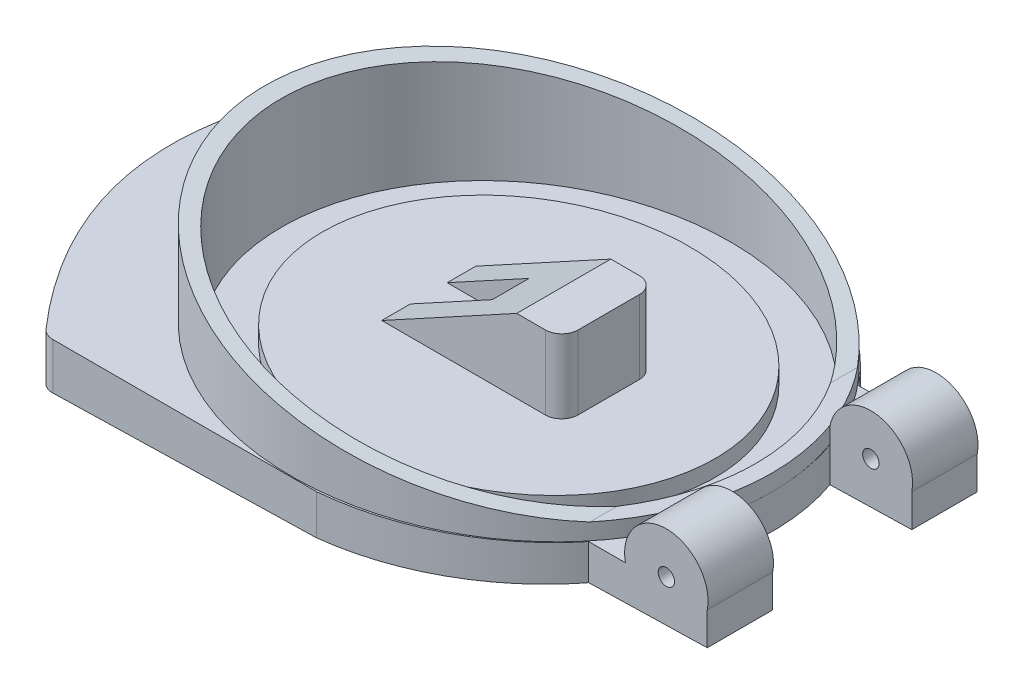
from build123d import *

# Parameters (mm, degrees)
BOSS_EXTRUDE5_DEPTH     = 4
SKETCH9_RX              = 31
SKETCH9_RY              = 27.762225355
SKETCH9_RX_2            = 29
SKETCH9_RY_2            = 25.88601257
BOSS_EXTRUDE6_DEPTH     = 12
CUT_EXTRUDE3_DEPTH      = 71
BOSS_EXTRUDE8_REACH     = 65.48
BOSS_EXTRUDE9_START     = -8
BOSS_EXTRUDE9_OUTLINE_R = 1
BOSS_EXTRUDE9_DEPTH     = 8
SKETCH14_RX             = 29
SKETCH14_RY             = 25.88601257
CUT_EXTRUDE4_DEPTH      = 2
BOSS_EXTRUDE10_DEPTH    = 9
SKETCH16_W              = 16.5
SKETCH16_H              = 3.468852831
CUT_EXTRUDE5_DEPTH      = 13
FILLET1_R               = 2
BOSS_EXTRUDE11_DEPTH    = 2
CUT_EXTRUDE6_DEPTH      = 80


with BuildPart() as part:
    # Sketch8 → Boss-Extrude5 (new body)
    with BuildSketch(Plane(origin=(0, 0, 0), x_dir=(1, 0, 0), z_dir=(0, 1, 0))):
        with BuildLine():
            add(Edge.make_bspline(
                [(-3.142440467, 27.855768953), (-31, 25.291948253), (-31, 0), (-31, -25.291948253), (-3.142440467, -27.855768953)],
                knots=[1.672339788, 1.672339788, 1.672339788, 3.141592654, 3.141592654, 4.610845519, 4.610845519, 4.610845519], degree=2, weights=[1, 0.742081211, 1, 0.742081211, 1]))
            Line((-3.142440467, 27.855768953), (-30, 27.855768953))
            add(Edge.make_bspline(
                [(-30, 27.855768953), (-55, 0), (-30, -27.855768953)],
                knots=[0, 0, 0, 1, 1, 1], degree=2))
            Line((-30, -27.855768953), (-3.142440467, -27.855768953))
        make_face()
        with BuildLine():
            add(Edge.make_bspline(
                [(31, 0), (31, 4.352704938), (29.537069195, 8.5)],
                knots=[0, 0, 0, 0.308438744, 0.308438744, 0.308438744], degree=2, weights=[1, 0.988131743, 1]))
            add(Edge.make_bspline(
                [(29.537069195, 8.5), (28.009992177, 12.829144588), (25.0456662, 16.5)],
                knots=[0.308438744, 0.308438744, 0.308438744, 0.630174456, 0.630174456, 0.630174456], degree=2, weights=[1, 0.987088646, 1]))
            add(Edge.make_bspline(
                [(25.0456662, 16.5), (16.89783711, 26.589815609), (3.142440467, 27.855768953)],
                knots=[0.630174456, 0.630174456, 0.630174456, 1.469252866, 1.469252866, 1.469252866], degree=2, weights=[1, 0.913276737, 1]))
            Line((3.142440467, 27.855768953), (-3.142440467, 27.855768953))
            add(Edge.make_bspline(
                [(-3.142440467, 27.855768953), (-31, 25.291948253), (-31, 0), (-31, -25.291948253), (-3.142440467, -27.855768953)],
                knots=[1.672339788, 1.672339788, 1.672339788, 3.141592654, 3.141592654, 4.610845519, 4.610845519, 4.610845519], degree=2, weights=[1, 0.742081211, 1, 0.742081211, 1]))
            Line((-3.142440467, -27.855768953), (3.142440467, -27.855768953))
            add(Edge.make_bspline(
                [(3.142440467, -27.855768953), (16.89783711, -26.589815609), (25.0456662, -16.5)],
                knots=[4.813932441, 4.813932441, 4.813932441, 5.653010851, 5.653010851, 5.653010851], degree=2, weights=[1, 0.913276737, 1]))
            add(Edge.make_bspline(
                [(25.0456662, -16.5), (28.009992177, -12.829144588), (29.537069195, -8.5)],
                knots=[5.653010851, 5.653010851, 5.653010851, 5.974746563, 5.974746563, 5.974746563], degree=2, weights=[1, 0.987088646, 1]))
            add(Edge.make_bspline(
                [(29.537069195, -8.5), (31, -4.352704938), (31, 0)],
                knots=[5.974746563, 5.974746563, 5.974746563, 6.283185307, 6.283185307, 6.283185307], degree=2, weights=[1, 0.988131743, 1]))
        make_face()
        with BuildLine():
            Line((39.537069195, -8.5), (29.537069195, -8.5))
            add(Edge.make_bspline(
                [(25.0456662, -16.5), (28.009992177, -12.829144588), (29.537069195, -8.5)],
                knots=[5.653010851, 5.653010851, 5.653010851, 5.974746563, 5.974746563, 5.974746563], degree=2, weights=[1, 0.987088646, 1]))
            Line((25.0456662, -16.5), (39.537069195, -16.5))
            Line((39.537069195, -16.5), (39.537069195, -8.5))
        make_face()
        with BuildLine():
            add(Edge.make_bspline(
                [(29.537069195, 8.5), (28.009992177, 12.829144588), (25.0456662, 16.5)],
                knots=[0.308438744, 0.308438744, 0.308438744, 0.630174456, 0.630174456, 0.630174456], degree=2, weights=[1, 0.987088646, 1]))
            Line((29.537069195, 8.5), (39.537069195, 8.5))
            Line((39.537069195, 8.5), (39.537069195, 16.5))
            Line((39.537069195, 16.5), (25.0456662, 16.5))
        make_face()
    extrude(amount=BOSS_EXTRUDE5_DEPTH)

    # Sketch9 → Boss-Extrude6 (add)
    with BuildSketch(Plane(origin=(0, 4, 0), x_dir=(1, 0, 0), z_dir=(0, 1, 0))):
        with Locations((0, 0)):
            Ellipse(SKETCH9_RX, SKETCH9_RY)
        with Locations((0, 0)):
            Ellipse(SKETCH9_RX_2, SKETCH9_RY_2, mode=Mode.SUBTRACT)
    extrude(amount=BOSS_EXTRUDE6_DEPTH)

    # Sketch10 → Cut-Extrude3 (cut)
    with BuildSketch(Plane.XY.offset(27.855768953)):
        Polygon((31, 6), (25.0456662, 6), (-31, 16), (-31, 18.812424775), (31, 18.812424775), align=None)
    extrude(amount=-CUT_EXTRUDE3_DEPTH, mode=Mode.SUBTRACT)

    # Boss-Extrude8: up to this face of the body (flat: up to its plane)
    boss_extrude8_end = Plane(part.part.faces().sort_by_distance((34.537069195, 2, 8.5))[0])
    # Sketch11 → Boss-Extrude8 (add, up to the picked face)
    with BuildSketch(Plane.XY.offset(16.5), mode=Mode.PRIVATE) as boss_extrude8_sk1:
        with BuildLine():
            Line((39.537069195, 5), (39.537069195, 4))
            ThreePointArc((39.537069195, 4), (39.611273446, 4.497554763), (39.636088709, 5))
            ThreePointArc((39.636088709, 5), (34.034623958, 10.074204251), (29.537069195, 4))
            Line((29.537069195, 4), (34.537069195, 4))
            ThreePointArc((34.537069195, 4), (33.829962414, 5.707106781), (35.537069195, 5))
            Line((35.537069195, 5), (39.537069195, 5))
        make_face()
    boss_extrude8_tool1 = split(extrude(boss_extrude8_sk1.sketch, amount=-BOSS_EXTRUDE8_REACH, mode=Mode.PRIVATE), bisect_by=boss_extrude8_end, keep=Keep.BOTH, mode=Mode.PRIVATE)
    # Sketch11 → Boss-Extrude8 (add, up to the picked face)
    with BuildSketch(Plane.XY.offset(16.5), mode=Mode.PRIVATE) as boss_extrude8_sk2:
        with BuildLine():
            Line((34.537069195, 4), (39.537069195, 4))
            Line((39.537069195, 4), (39.537069195, 5))
            Line((39.537069195, 5), (35.537069195, 5))
            ThreePointArc((35.537069195, 5), (35.244175976, 4.292893219), (34.537069195, 4))
        make_face()
    boss_extrude8_tool2 = split(extrude(boss_extrude8_sk2.sketch, amount=-BOSS_EXTRUDE8_REACH, mode=Mode.PRIVATE), bisect_by=boss_extrude8_end, keep=Keep.BOTH, mode=Mode.PRIVATE)
    # Sketch11 → Boss-Extrude8 (add, up to the picked face)
    with BuildSketch(Plane.XY.offset(16.5), mode=Mode.PRIVATE) as boss_extrude8_sk3:
        with BuildLine():
            ThreePointArc((35.537069195, 0), (38.142620471, 1.394448725), (39.537069195, 4))
            Line((39.537069195, 4), (34.537069195, 4))
            Line((34.537069195, 4), (34.537069195, 0))
            Line((34.537069195, 0), (35.537069195, 0))
        make_face()
    boss_extrude8_tool3 = split(extrude(boss_extrude8_sk3.sketch, amount=-BOSS_EXTRUDE8_REACH, mode=Mode.PRIVATE), bisect_by=boss_extrude8_end, keep=Keep.BOTH, mode=Mode.PRIVATE)
    # Sketch11 → Boss-Extrude8 (add, up to the picked face)
    with BuildSketch(Plane.XY.offset(16.5), mode=Mode.PRIVATE) as boss_extrude8_sk4:
        with BuildLine():
            Line((34.537069195, 0), (34.537069195, 4))
            Line((34.537069195, 4), (29.537069195, 4))
            ThreePointArc((29.537069195, 4), (30.93151792, 1.394448725), (33.537069195, 0))
            Line((33.537069195, 0), (34.537069195, 0))
        make_face()
    boss_extrude8_tool4 = split(extrude(boss_extrude8_sk4.sketch, amount=-BOSS_EXTRUDE8_REACH, mode=Mode.PRIVATE), bisect_by=boss_extrude8_end, keep=Keep.BOTH, mode=Mode.PRIVATE)
    # Sketch11 → Boss-Extrude8 (add, up to the picked face)
    with BuildSketch(Plane.XY.offset(16.5), mode=Mode.PRIVATE) as boss_extrude8_sk5:
        with BuildLine():
            ThreePointArc((35.537069195, 0), (38.142620471, 1.394448725), (39.537069195, 4))
            Line((39.537069195, 4), (34.537069195, 4))
            Line((34.537069195, 4), (34.537069195, 0))
            Line((34.537069195, 0), (35.537069195, 0))
        make_face()
    boss_extrude8_tool5 = split(extrude(boss_extrude8_sk5.sketch, amount=-BOSS_EXTRUDE8_REACH, mode=Mode.PRIVATE), bisect_by=boss_extrude8_end, keep=Keep.BOTH, mode=Mode.PRIVATE)
    # Sketch11 → Boss-Extrude8 (add, up to the picked face)
    with BuildSketch(Plane.XY.offset(16.5), mode=Mode.PRIVATE) as boss_extrude8_sk6:
        with BuildLine():
            Line((34.537069195, 0), (34.537069195, 4))
            Line((34.537069195, 4), (29.537069195, 4))
            ThreePointArc((29.537069195, 4), (30.93151792, 1.394448725), (33.537069195, 0))
            Line((33.537069195, 0), (34.537069195, 0))
        make_face()
    boss_extrude8_tool6 = split(extrude(boss_extrude8_sk6.sketch, amount=-BOSS_EXTRUDE8_REACH, mode=Mode.PRIVATE), bisect_by=boss_extrude8_end, keep=Keep.BOTH, mode=Mode.PRIVATE)
    add(boss_extrude8_tool1.solids().sort_by(Axis((34.258125, 6.960254, 16.5), (0, 0, -1)))[0])
    add(boss_extrude8_tool2.solids().sort_by(Axis((37.423858, 4.485914, 16.5), (0, 0, -1)))[0])
    add(boss_extrude8_tool3.solids().sort_by(Axis((36.586598, 2.296366, 16.5), (0, 0, -1)))[0])
    add(boss_extrude8_tool4.solids().sort_by(Axis((32.487541, 2.296366, 16.5), (0, 0, -1)))[0])
    add(boss_extrude8_tool5.solids().sort_by(Axis((36.586598, 2.296366, 16.5), (0, 0, -1)))[0])
    add(boss_extrude8_tool6.solids().sort_by(Axis((32.487541, 2.296366, 16.5), (0, 0, -1)))[0])

    # Boss-Extrude9: read off the stored shape, not the designer's step
    # Boss-Extrude9 outline → Boss-Extrude9 (add)
    with BuildSketch(Plane(origin=(0, 0, -16.5), x_dir=(-1, 0, 0), z_dir=(0, 0, -1)).offset(BOSS_EXTRUDE9_START)):
        with BuildLine():
            Line((-39.537069195, 0), (-29.537069195, 0))
            Line((-29.537069195, 0), (-29.537069195, 4))
            ThreePointArc((-29.537069195, 4), (-34.537069195, 10.099019514), (-39.537069195, 4))
            Line((-39.537069195, 4), (-39.537069195, 0))
        make_face()
        with Locations((-34.537069195, 5)):
            Circle(BOSS_EXTRUDE9_OUTLINE_R, mode=Mode.SUBTRACT)
    extrude(amount=BOSS_EXTRUDE9_DEPTH)

    # Sketch14 → Cut-Extrude4 (cut)
    with BuildSketch(Plane(origin=(0, 4, 0), x_dir=(1, 0, 0), z_dir=(0, 1, 0))):
        with Locations((0, 0)):
            Ellipse(SKETCH14_RX, SKETCH14_RY)
        with BuildLine():
            add(Edge.make_bspline(
                [(-24, 0), (-24, -1.485571892), (-23.819251723, -2.939586681), (-23.380607635, -4.71996804), (-23.282127918, -5.074167296), (-23.063547173, -5.778790914), (-22.943013156, -6.130319407), (-22.552045751, -7.170100263), (-22.25322805, -7.842229287), (-21.583951829, -9.146966289), (-21.213474865, -9.77956409), (-20.605601145, -10.699687398), (-20.394265258, -11.001589523), (-19.954227091, -11.595813509), (-19.725205499, -11.888437191), (-18.549551348, -13.31251534), (-17.503587602, -14.340598074), (-15.790906033, -15.731162346), (-15.193048144, -16.170982445), (-13.964001563, -16.990230685), (-13.33425146, -17.369162437), (-11.401841767, -18.418962219), (-10.056381473, -19.003557763), (-7.95492563, -19.712614742), (-7.244918135, -19.919106547), (-5.819510859, -20.271015729), (-5.102097487, -20.417118397), (-2.936080708, -20.76810518), (-1.472912691, -20.886396982), (1.487226311, -20.885626293), (2.947448764, -20.766720139), (5.829362495, -20.298810842), (7.251068476, -19.949895503), (9.352582716, -19.241132362), (10.042207721, -18.975449852), (11.385766272, -18.390716298), (12.041915051, -18.070935077), (13.962852858, -17.02826586), (15.18068639, -16.223022275), (16.615285819, -15.0626633), (16.898590142, -14.822059809), (17.450029115, -14.329962511), (17.718559834, -14.078223767), (18.502618066, -13.305962876), (18.996666494, -12.768439476), (20.391166545, -11.08649581), (21.205184713, -9.873661226), (22.057330783, -8.226718106), (22.218658782, -7.891961595), (22.519762285, -7.218617308), (22.660067316, -6.879024207), (23.050355767, -5.851514393), (23.269796194, -5.154891012), (23.625791485, -3.73801667), (23.762361214, -3.017769947), (23.901884637, -1.918776385), (23.937547988, -1.547924859), (23.985772954, -0.807743265), (23.998425902, -0.438692153), (24.00560704, 1.401475126), (23.833707077, 2.857491822), (23.397299482, 4.657413771), (23.29858556, 5.016916905), (23.081487549, 5.724541562), (22.962866642, 6.073807369), (22.577716516, 7.108384271), (22.281979735, 7.780510885), (21.615390776, 9.090856544), (21.244348292, 9.7293491), (20.428208934, 10.971453219), (19.989729933, 11.565107819), (19.056233765, 12.701478624), (18.56119892, 13.244178901), (17.516781277, 14.280614345), (16.966373381, 14.775166589), (15.240855529, 16.180855811), (14.017206625, 16.995244051), (12.082455842, 18.05059866), (11.420849673, 18.374439464), (10.064536777, 18.966698289), (9.371990416, 19.233865059), (7.280490874, 19.941381269), (5.857230969, 20.293296464), (3.68055752, 20.648177963), (2.947026927, 20.737525259), (1.46969286, 20.85671199), (0.733434074, 20.886025708), (-1.468344878, 20.88598628), (-2.926924566, 20.769368338), (-5.100717489, 20.417451826), (-5.822955014, 20.270471849), (-7.262494562, 19.91445629), (-7.970653239, 19.70762152), (-10.055368967, 19.003265547), (-11.394922112, 18.422076902), (-13.325081847, 17.374463005), (-13.9551914, 16.995771038), (-14.879061582, 16.380440291), (-15.183942932, 16.167018413), (-15.779425792, 15.728910962), (-16.070851312, 15.503713206), (-17.496423786, 14.347028025), (-18.536899054, 13.324418057), (-19.936672229, 11.633943125), (-20.376254603, 11.0441778), (-20.991575929, 10.116676396), (-21.189010955, 9.800650215), (-21.563177201, 9.163134509), (-21.740653577, 8.840553735), (-22.580098941, 7.208573949), (-23.09991132, 5.842604961), (-23.634786865, 3.696218343), (-23.772064027, 2.960593132), (-23.908599718, 1.85499931), (-23.942803559, 1.485442952), (-23.988503571, 0.744271767), (-24, 0.371392973), (-24, 0)],
                knots=[0, 0, 0, 0, 0.03125, 0.03125, 0.0390625, 0.0390625, 0.046875, 0.046875, 0.0625, 0.0625, 0.078125, 0.078125, 0.0859375, 0.0859375, 0.09375, 0.09375, 0.125, 0.125, 0.140625, 0.140625, 0.15625, 0.15625, 0.1875, 0.1875, 0.203125, 0.203125, 0.21875, 0.21875, 0.25, 0.25, 0.28125, 0.28125, 0.3125, 0.3125, 0.328125, 0.328125, 0.34375, 0.34375, 0.375, 0.375, 0.3828125, 0.3828125, 0.390625, 0.390625, 0.40625, 0.40625, 0.4375, 0.4375, 0.4453125, 0.4453125, 0.453125, 0.453125, 0.46875, 0.46875, 0.484375, 0.484375, 0.4921875, 0.4921875, 0.5, 0.5, 0.53125, 0.53125, 0.5390625, 0.5390625, 0.546875, 0.546875, 0.5625, 0.5625, 0.578125, 0.578125, 0.59375, 0.59375, 0.609375, 0.609375, 0.625, 0.625, 0.65625, 0.65625, 0.671875, 0.671875, 0.6875, 0.6875, 0.71875, 0.71875, 0.734375, 0.734375, 0.75, 0.75, 0.78125, 0.78125, 0.796875, 0.796875, 0.8125, 0.8125, 0.84375, 0.84375, 0.859375, 0.859375, 0.8671875, 0.8671875, 0.875, 0.875, 0.90625, 0.90625, 0.921875, 0.921875, 0.9296875, 0.9296875, 0.9375, 0.9375, 0.96875, 0.96875, 0.984375, 0.984375, 0.9921875, 0.9921875, 1, 1, 1, 1], degree=3))
        make_face(mode=Mode.SUBTRACT)
    extrude(amount=-CUT_EXTRUDE4_DEPTH, mode=Mode.SUBTRACT)

    # Sketch15 → Boss-Extrude10 (add)
    with BuildSketch(Plane(origin=(0, 4, 0), x_dir=(1, 0, 0), z_dir=(0, 1, 0))):
        Polygon((-0.999998544, -2.25), (-10.999998544, -2.25), (-10.999998544, -5.75), (11.000001456, -5.75), (11.000001456, 0), (11.000001456, 5.75), (-10.999998544, 5.75), (-10.999998544, 2.25), (-0.999998544, 2.25), align=None)
    extrude(amount=BOSS_EXTRUDE10_DEPTH)

    # Sketch16 → Cut-Extrude5 (cut)
    with BuildSketch(Plane.XY.offset(5.75)):
        with Locations((-2.749998544, 14.734426415)):
            Rectangle(SKETCH16_W, SKETCH16_H)
        Polygon((-10.999998544, 4), (5.500001456, 13), (-10.999998544, 13), align=None)
    extrude(amount=-CUT_EXTRUDE5_DEPTH, mode=Mode.SUBTRACT)

    # Fillet1
    fillet1_edges = [part.edges().sort_by_distance(p)[0] for p in [
        (-30, 2, -27.855768953),
        (-30, 2, 27.855768953),
        (11.000001456, 8.5, -5.75),
        (11.000001456, 8.5, 5.75),
    ]]
    fillet(fillet1_edges, radius=FILLET1_R)

    # Sketch17 → Boss-Extrude11 (add)
    with BuildSketch(Plane.XZ):
        with BuildLine():
            Line((-29.10030253, -27.855768953), (3.142440467, -27.855768953))
            add(Edge.make_bspline(
                [(3.142440467, -27.855768953), (16.89783711, -26.589815609), (25.0456662, -16.5)],
                knots=[4.813932441, 4.813932441, 4.813932441, 5.653010851, 5.653010851, 5.653010851], degree=2, weights=[1, 0.913276737, 1]))
            Line((25.0456662, -16.5), (39.537069195, -16.5))
            Line((39.537069195, -16.5), (39.537069195, -8.5))
            Line((39.537069195, -8.5), (29.537069195, -8.5))
            add(Edge.make_bspline(
                [(29.537069195, -8.5), (32.535387775, 0), (29.537069195, 8.5)],
                knots=[5.974746563, 5.974746563, 5.974746563, 6.591624051, 6.591624051, 6.591624051], degree=2, weights=[1, 0.952808684, 1]))
            Line((29.537069195, 8.5), (39.537069195, 8.5))
            Line((39.537069195, 8.5), (39.537069195, 16.5))
            Line((39.537069195, 16.5), (25.0456662, 16.5))
            add(Edge.make_bspline(
                [(25.0456662, 16.5), (16.89783711, 26.589815609), (3.142440467, 27.855768953)],
                knots=[0.630174456, 0.630174456, 0.630174456, 1.469252866, 1.469252866, 1.469252866], degree=2, weights=[1, 0.913276737, 1]))
            Line((3.142440467, 27.855768953), (-29.10030253, 27.855768953))
            ThreePointArc((-29.10030253, 27.855768953), (-29.926483262, 27.677149033), (-30.605091659, 27.17319435))
            add(Edge.make_bspline(
                [(-30.605091659, 27.17319435), (-54.394908353, -1.3e-08), (-30.605091635, -27.173194376)],
                knots=[0, 0, 0, 1, 1, 1], degree=2))
            ThreePointArc((-30.605091635, -27.173194376), (-29.926483246, -27.67714904), (-29.10030253, -27.855768953))
        make_face()
    extrude(amount=BOSS_EXTRUDE11_DEPTH)

    # Sketch18 → Cut-Extrude6 (cut)
    with BuildSketch(Plane.XY.offset(27.855768953)):
        Polygon((-42.5, -2), (39.537069195, 0), (39.537069195, -5.588135223), (-42.5, -7.173835865), align=None)
    extrude(amount=-CUT_EXTRUDE6_DEPTH, mode=Mode.SUBTRACT)


solid = part.part
